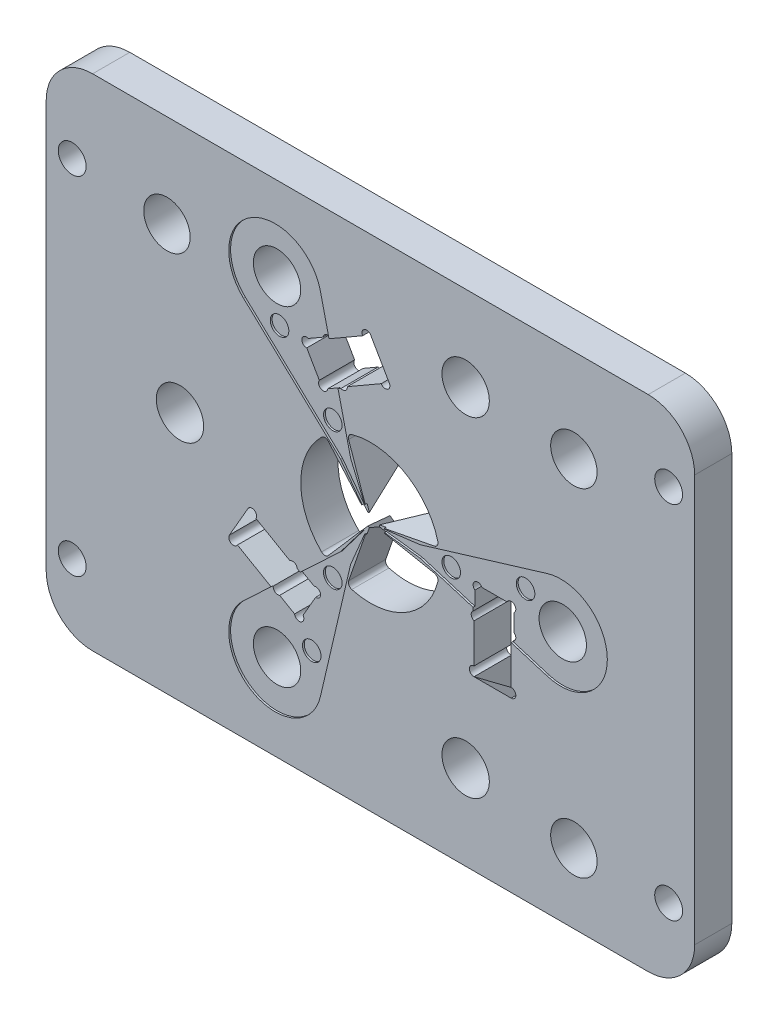
from build123d import *
from build123d.topology import SkipClean

# Parameters (mm, degrees)
SKETCH_1_W           = 76
SKETCH_1_H           = 60
EXTRUDE_1_DEPTH      = 4
CUT_EXTRUDE_1_DEPTH  = 0.5
SKETCH_3_R           = 2.55
CUT_EXTRUDE_2_DEPTH  = 49.541219597
SKETCH_5_R           = 2.55
CUT_EXTRUDE_4_DEPTH  = 49.579831206
SKETCH_6_W           = 76
SKETCH_6_H           = 60
CUT_EXTRUDE_5_DEPTH  = 10
CUT_EXTRUDE_6_DEPTH  = 45.244999717
SKETCH_8_R           = 1.5
CUT_EXTRUDE_7_DEPTH  = 45.244999717
EXTRUDE_START        = 0.5
SKETCH_10_R          = 2.55
EXTRUDE_2_DEPTH      = 0.5
CUT_EXTRUDE_9_DEPTH  = 45.244999717
SKETCH_13_R          = 2.5
CUT_EXTRUDE_10_DEPTH = 45.244999717
SKETCH_14_W          = 4
SKETCH_14_H          = 4.45
CUT_EXTRUDE_11_DEPTH = 0.9
CUT_EXTRUDE_12_DEPTH = 0.2
CUT_EXTRUDE_15_DEPTH = 4
CUT_EXTRUDE_16_DEPTH = 4
CUT_EXTRUDE_17_DEPTH = 4
SKETCH_20_R          = 1.526637958
CUT_EXTRUDE_18_DEPTH = 0.2
SKETCH_21_R          = 1
CUT_EXTRUDE_19_DEPTH = 0.2
CUT_EXTRUDE_20_DEPTH = 45.172729144


with BuildPart() as part:
    # 草圖1 → 填料-伸長1 (new body)
    with BuildSketch(Plane.XY):
        Rectangle(SKETCH_1_W, SKETCH_1_H)
    extrude(amount=EXTRUDE_1_DEPTH)

    # 草圖2 → 除料-伸長1 (cut)
    with BuildSketch(Plane.XY.offset(4)):
        with BuildLine():
            Line((0.357380647, 0.004961492), (4.50941379, 0.523267787))
            ThreePointArc((4.50941379, 0.523267787), (5.349803134, 0.664770922), (6.175092484, 0.877314741))
            Line((6.175092484, 0.877314741), (19.047808057, 4.784468472))
            ThreePointArc((19.047808057, 4.784468472), (25.5, 0), (19.047808057, -4.784468472))
            Line((19.047808057, -4.784468472), (6.175092484, -0.877314741))
            ThreePointArc((6.175092484, -0.877314741), (5.349803134, -0.664770922), (4.50941379, -0.523267787))
            Line((4.50941379, -0.523267787), (0.357380647, -0.004961492))
            ThreePointArc((0.357380647, -0.004961492), (0.353, 0), (0.357380647, 0.004961492))
        make_face()
        with BuildLine():
            Line((-2.327769389, -5.786444332), (-5.380432788, -18.8881199))
            ThreePointArc((-5.380432788, -18.8881199), (-12.75, -22.083647797), (-13.667375269, -14.103651428))
            Line((-13.667375269, -14.103651428), (-3.847323094, -4.909129591))
            ThreePointArc((-3.847323094, -4.909129591), (-3.250610073, -4.300679958), (-2.707870091, -3.643633005))
            Line((-2.707870091, -3.643633005), (-0.182987102, -0.307019973))
            ThreePointArc((-0.182987102, -0.307019973), (-0.1765, -0.305706968), (-0.174393546, -0.311981465))
            Line((-0.174393546, -0.311981465), (-1.801543699, -4.166900792))
            ThreePointArc((-1.801543699, -4.166900792), (-2.09919306, -4.96545088), (-2.327769389, -5.786444332))
        make_face()
        with BuildLine():
            Line((-3.847323094, 4.909129591), (-13.667375269, 14.103651428))
            ThreePointArc((-13.667375269, 14.103651428), (-12.75, 22.083647797), (-5.380432788, 18.8881199))
            Line((-5.380432788, 18.8881199), (-2.327769389, 5.786444332))
            ThreePointArc((-2.327769389, 5.786444332), (-2.09919306, 4.96545088), (-1.801543699, 4.166900792))
            Line((-1.801543699, 4.166900792), (-0.174393546, 0.311981465))
            ThreePointArc((-0.174393546, 0.311981465), (-0.1765, 0.305706968), (-0.182987102, 0.307019973))
            Line((-0.182987102, 0.307019973), (-2.707870091, 3.643633005))
            ThreePointArc((-2.707870091, 3.643633005), (-3.250610073, 4.300679958), (-3.847323094, 4.909129591))
        make_face()
    extrude(amount=-CUT_EXTRUDE_1_DEPTH, mode=Mode.SUBTRACT)

    # 草圖3 → 除料-伸長2 (cut, through all)
    with BuildSketch(Plane.XY.offset(3.5)):
        with Locations((20.5, 0)):
            Circle(SKETCH_3_R)
        with Locations((-10.25, -17.753520778)):
            Circle(SKETCH_3_R)
        with Locations((-10.25, 17.753520778)):
            Circle(SKETCH_3_R)
    extrude(amount=-CUT_EXTRUDE_2_DEPTH, mode=Mode.SUBTRACT)

    # 草圖5 → 除料-伸長4 (cut, through all)
    with BuildSketch(Plane.XY.offset(4)):
        with Locations((-20.5, 0)):
            Circle(SKETCH_5_R)
        with Locations((10.25, 17.753520778)):
            Circle(SKETCH_5_R)
        with Locations((10.25, -17.753520778)):
            Circle(SKETCH_5_R)
    extrude(amount=-CUT_EXTRUDE_4_DEPTH, mode=Mode.SUBTRACT)

    # 草圖6 → 除料-伸長5 (cut)
    with BuildSketch(Plane.XY.offset(4)):
        Rectangle(SKETCH_6_W, SKETCH_6_H)
        with BuildLine():
            ThreePointArc((-34.9, 21.9), (-33.435533906, 25.435533906), (-29.9, 26.9))
            Line((-29.9, 26.9), (29.9, 26.9))
            ThreePointArc((29.9, 26.9), (33.435533906, 25.435533906), (34.9, 21.9))
            Line((34.9, 21.9), (34.9, -21.9))
            ThreePointArc((34.9, -21.9), (33.435533906, -25.435533906), (29.9, -26.9))
            Line((29.9, -26.9), (-29.9, -26.9))
            ThreePointArc((-29.9, -26.9), (-33.435533906, -25.435533906), (-34.9, -21.9))
            Line((-34.9, -21.9), (-34.9, 21.9))
        make_face(mode=Mode.SUBTRACT)
    extrude(amount=-CUT_EXTRUDE_5_DEPTH, mode=Mode.SUBTRACT)

    # 草圖7 → 除料-伸長6 (cut, through all)
    with BuildSketch(Plane.XY.offset(4)):
        with BuildLine():
            ThreePointArc((11.798296094, -0.228571429), (11.03056096, -0.065346), (11.05, -0.85))
            Line((11.05, -0.85), (11.05, -2.707142857))
            ThreePointArc((11.05, -2.707142857), (11.03056096, -3.491796857), (11.798296094, -3.328571429))
            Line((11.798296094, -3.328571429), (14.501703906, -3.328571429))
            ThreePointArc((14.501703906, -3.328571429), (15.26943904, -3.491796857), (15.25, -2.707142857))
            Line((15.25, -2.707142857), (15.25, -0.85))
            ThreePointArc((15.25, -0.85), (15.26943904, -0.065346), (14.501703906, -0.228571429))
            Line((14.501703906, -0.228571429), (11.798296094, -0.228571429))
        make_face()
        with BuildLine():
            ThreePointArc((-6.888878407, 13.631887408), (-7.578128224, 13.25639511), (-7.052903289, 12.673129695))
            Line((-7.052903289, 12.673129695), (-5.701199383, 10.331909853))
            ThreePointArc((-5.701199383, 10.331909853), (-5.458689184, 9.585419009), (-4.788878407, 9.994580712))
            Line((-4.788878407, 9.994580712), (-3.180545514, 10.92315214))
            ThreePointArc((-3.180545514, 10.92315214), (-2.491295697, 11.298644438), (-3.016520631, 11.881909853))
            Line((-3.016520631, 11.881909853), (-4.368224538, 14.223129695))
            ThreePointArc((-4.368224538, 14.223129695), (-4.610734737, 14.969620539), (-5.280545514, 14.560458836))
            Line((-5.280545514, 14.560458836), (-6.888878407, 13.631887408))
        make_face()
        with BuildLine():
            Line((15.15, -7.778571429), (11.15, -7.778571429))
            ThreePointArc((11.15, -7.778571429), (10.65, -8.278571429), (11.15, -8.778571429))
            Line((11.15, -8.778571429), (15.15, -8.778571429))
            ThreePointArc((15.15, -8.778571429), (15.65, -8.278571429), (15.15, -7.778571429))
        make_face()
        with BuildLine():
            Line((2.027465866, 14.045468966), (0.027465866, 17.509570582))
            ThreePointArc((0.027465866, 17.509570582), (-0.655546836, 17.692583284), (-0.838559538, 17.009570582))
            Line((-0.838559538, 17.009570582), (1.161440462, 13.545468966))
            ThreePointArc((1.161440462, 13.545468966), (1.844453164, 13.362456265), (2.027465866, 14.045468966))
        make_face()
        with BuildLine():
            Line((-6.261121593, -9.144580712), (-7.869454486, -8.216009283))
            ThreePointArc((-7.869454486, -8.216009283), (-8.539265263, -7.806847581), (-8.781775462, -8.553338424))
            Line((-8.781775462, -8.553338424), (-10.133479369, -10.894558267))
            ThreePointArc((-10.133479369, -10.894558267), (-10.658704303, -11.477823681), (-9.969454486, -11.853315979))
            Line((-9.969454486, -11.853315979), (-8.361121593, -12.781887408))
            ThreePointArc((-8.361121593, -12.781887408), (-7.691310816, -13.19104911), (-7.448800617, -12.444558267))
            Line((-7.448800617, -12.444558267), (-6.097096711, -10.103338424))
            ThreePointArc((-6.097096711, -10.103338424), (-5.571871776, -9.520073009), (-6.261121593, -9.144580712))
        make_face()
        with BuildLine():
            Line((-14.311440462, -9.230999153), (-12.311440462, -5.766897538))
            ThreePointArc((-12.311440462, -5.766897538), (-12.494453164, -5.083884836), (-13.177465866, -5.266897538))
            Line((-13.177465866, -5.266897538), (-15.177465866, -8.730999153))
            ThreePointArc((-15.177465866, -8.730999153), (-14.994453164, -9.414011855), (-14.311440462, -9.230999153))
        make_face()
    extrude(amount=-CUT_EXTRUDE_6_DEPTH, mode=Mode.SUBTRACT)

    # 草圖8 → 除料-伸長7 (cut, through all)
    with BuildSketch(Plane.XY):
        with Locations((-32.1, 17.9)):
            Circle(SKETCH_8_R)
        with Locations((32.1, 19.4)):
            Circle(SKETCH_8_R)
        with Locations((32.1, -19.4)):
            Circle(SKETCH_8_R)
        with Locations((-32.1, -19.4)):
            Circle(SKETCH_8_R)
    extrude(amount=CUT_EXTRUDE_7_DEPTH, mode=Mode.SUBTRACT)

    # 草圖10 → 填料-伸長2 (add)
    # profile 1 of 3: a face of its own
    with SkipClean():  # the faces are left unmerged after this step: merging them gives an invalid solid
        with BuildSketch(Plane.XY.offset(3.5).offset(EXTRUDE_START)):
            with BuildLine():
                Line((-3.847323094, -4.909129591), (-7.56618458, -8.391102245))
                Line((-7.56618458, -8.391102245), (-6.261121593, -9.144580712))
                ThreePointArc((-6.261121593, -9.144580712), (-5.571871776, -9.520073009), (-6.097096711, -10.103338424))
                Line((-6.097096711, -10.103338424), (-7.448800617, -12.444558267))
                ThreePointArc((-7.448800617, -12.444558267), (-7.691310816, -13.19104911), (-8.361121593, -12.781887408))
                Line((-8.361121593, -12.781887408), (-9.969454486, -11.853315979))
                ThreePointArc((-9.969454486, -11.853315979), (-10.48667114, -11.777022627), (-10.653138837, -11.281419712))
                Line((-10.653138837, -11.281419712), (-13.667375269, -14.103651428))
                ThreePointArc((-13.667375269, -14.103651428), (-12.75, -22.083647797), (-5.380432788, -18.8881199))
                Line((-5.380432788, -18.8881199), (-2.327769389, -5.786444332))
                ThreePointArc((-2.327769389, -5.786444332), (-2.09919306, -4.96545088), (-1.801543699, -4.166900792))
                Line((-1.801543699, -4.166900792), (-0.174393546, -0.311981465))
                ThreePointArc((-0.174393546, -0.311981465), (-0.1765, -0.305706968), (-0.182987102, -0.307019973))
                Line((-0.182987102, -0.307019973), (-2.707870091, -3.643633005))
                ThreePointArc((-2.707870091, -3.643633005), (-3.250610073, -4.300679958), (-3.847323094, -4.909129591))
            make_face()
            with Locations((-10.25, -17.753520778)):
                Circle(SKETCH_10_R, mode=Mode.SUBTRACT)
        # profile 2 of 3: a face of its own
        with BuildSketch(Plane.XY.offset(3.5).offset(EXTRUDE_START)):
            with BuildLine():
                Line((11.05, -2.356956933), (11.05, -0.85))
                ThreePointArc((11.05, -0.85), (11.03056096, -0.065346), (11.798296094, -0.228571429))
                Line((11.798296094, -0.228571429), (14.501703906, -0.228571429))
                ThreePointArc((14.501703906, -0.228571429), (15.26943904, -0.065346), (15.25, -0.85))
                Line((15.25, -0.85), (15.25, -2.707142857))
                ThreePointArc((15.25, -2.707142857), (15.442536346, -3.193212295), (15.09656548, -3.585179007))
                Line((15.09656548, -3.585179007), (19.047808057, -4.784468472))
                ThreePointArc((19.047808057, -4.784468472), (25.5, 0), (19.047808057, 4.784468472))
                Line((19.047808057, 4.784468472), (6.175092484, 0.877314741))
                ThreePointArc((6.175092484, 0.877314741), (5.349803134, 0.664770922), (4.50941379, 0.523267787))
                Line((4.50941379, 0.523267787), (0.357380647, 0.004961492))
                ThreePointArc((0.357380647, 0.004961492), (0.353, 0), (0.357380647, -0.004961492))
                Line((0.357380647, -0.004961492), (4.50941379, -0.523267787))
                ThreePointArc((4.50941379, -0.523267787), (5.349803134, -0.664770922), (6.175092484, -0.877314741))
                Line((6.175092484, -0.877314741), (11.05, -2.356956933))
            make_face()
            with Locations((20.5, 0)):
                Circle(SKETCH_10_R, mode=Mode.SUBTRACT)
        # profile 3 of 3: a face of its own
        with BuildSketch(Plane.XY.offset(3.5).offset(EXTRUDE_START)):
            with BuildLine():
                Line((-3.48381542, 10.748059178), (-4.788878407, 9.994580712))
                ThreePointArc((-4.788878407, 9.994580712), (-5.458689184, 9.585419009), (-5.701199383, 10.331909853))
                Line((-5.701199383, 10.331909853), (-7.052903289, 12.673129695))
                ThreePointArc((-7.052903289, 12.673129695), (-7.578128224, 13.25639511), (-6.888878407, 13.631887408))
                Line((-6.888878407, 13.631887408), (-5.280545514, 14.560458836))
                ThreePointArc((-5.280545514, 14.560458836), (-4.955865206, 14.970234922), (-4.443426643, 14.866598719))
                Line((-4.443426643, 14.866598719), (-5.380432788, 18.8881199))
                ThreePointArc((-5.380432788, 18.8881199), (-12.75, 22.083647797), (-13.667375269, 14.103651428))
                Line((-13.667375269, 14.103651428), (-3.847323094, 4.909129591))
                ThreePointArc((-3.847323094, 4.909129591), (-3.250610073, 4.300679958), (-2.707870091, 3.643633005))
                Line((-2.707870091, 3.643633005), (-0.182987102, 0.307019973))
                ThreePointArc((-0.182987102, 0.307019973), (-0.1765, 0.305706968), (-0.174393546, 0.311981465))
                Line((-0.174393546, 0.311981465), (-1.801543699, 4.166900792))
                ThreePointArc((-1.801543699, 4.166900792), (-2.09919306, 4.96545088), (-2.327769389, 5.786444332))
                Line((-2.327769389, 5.786444332), (-3.48381542, 10.748059178))
            make_face()
            with Locations((-10.25, 17.753520778)):
                Circle(SKETCH_10_R, mode=Mode.SUBTRACT)
        extrude(amount=-EXTRUDE_2_DEPTH)

    # 草圖11 → 除料-伸長9 (cut, through all)
    with SkipClean():  # the faces are left unmerged after this step: merging them gives an invalid solid
        with BuildSketch(Plane.XY.offset(4)):
            with BuildLine():
                Line((6.872043561, 1.260060854), (0.357368236, 0.004959927))
                ThreePointArc((0.357368236, 0.004959927), (0.353, 0), (0.357368236, -0.004959927))
                Line((0.357368236, -0.004959927), (6.872043561, -1.260060854))
                ThreePointArc((6.872043561, -1.260060854), (7.200064401, -1.483823168), (7.261558134, -1.87610593))
                ThreePointArc((7.261558134, -1.87610593), (3.75, -6.495190528), (-2.006023672, -7.22674678))
                ThreePointArc((-2.006023672, -7.22674678), (-2.315003643, -6.977350264), (-2.344777071, -6.581394727))
                Line((-2.344777071, -6.581394727), (-0.174388695, -0.311969934))
                ThreePointArc((-0.174388695, -0.311969934), (-0.1765, -0.305706968), (-0.18297954, -0.307010007))
                Line((-0.18297954, -0.307010007), (-4.52726649, -5.321333873))
                ThreePointArc((-4.52726649, -5.321333873), (-4.885060759, -5.493527096), (-5.255534463, -5.350640851))
                ThreePointArc((-5.255534463, -5.350640851), (-7.5, 0), (-5.255534463, 5.350640851))
                ThreePointArc((-5.255534463, 5.350640851), (-4.885060759, 5.493527096), (-4.52726649, 5.321333873))
                Line((-4.52726649, 5.321333873), (-0.18297954, 0.307010007))
                ThreePointArc((-0.18297954, 0.307010007), (-0.1765, 0.305706968), (-0.174388695, 0.311969934))
                Line((-0.174388695, 0.311969934), (-2.344777071, 6.581394727))
                ThreePointArc((-2.344777071, 6.581394727), (-2.315003643, 6.977350264), (-2.006023672, 7.22674678))
                ThreePointArc((-2.006023672, 7.22674678), (3.75, 6.495190528), (7.261558134, 1.87610593))
                ThreePointArc((7.261558134, 1.87610593), (7.200064401, 1.483823168), (6.872043561, 1.260060854))
            make_face()
        extrude(amount=-CUT_EXTRUDE_9_DEPTH, mode=Mode.SUBTRACT)

    # 草圖12 → 除料-旋轉1 (revolve, cut)
    with SkipClean():  # the faces are left unmerged after this step: merging them gives an invalid solid
        with BuildSketch(Plane(origin=(0, 0, 0), x_dir=(1, 0, 0), z_dir=(0, 1, 0))):
            Polygon((0.353, -4.18), (0.353, 0), (2.766324125, 0), align=None)
        revolve(axis=Axis((0, 0, 0), (0, 0, 1)), mode=Mode.SUBTRACT)

    # 草圖13 → 除料-伸長10 (cut, through all)
    with SkipClean():  # the faces are left unmerged after this step: merging them gives an invalid solid
        with BuildSketch(Plane(origin=(0, 0, 0), x_dir=(-1, 0, 0), z_dir=(0, 0, -1))):
            with Locations((-21.9, 16.9)):
                Circle(SKETCH_13_R)
            with Locations((21.9, 16.9)):
                Circle(SKETCH_13_R)
            with Locations((-21.9, -19.4)):
                Circle(SKETCH_13_R)
        extrude(amount=-CUT_EXTRUDE_10_DEPTH, mode=Mode.SUBTRACT)

    # 草圖14 → 除料-伸長11 (cut)
    with SkipClean():  # the faces are left unmerged after this step: merging them gives an invalid solid
        with BuildSketch(Plane.XY.offset(4)):
            with Locations((13.15, -5.553571429)):
                Rectangle(SKETCH_14_W, SKETCH_14_H)
            Polygon((-4.692372585, 14.784570582), (-2.692372585, 11.320468966), (1.161440462, 13.545468966), (-0.838559538, 17.009570582), align=None)
            Polygon((-14.311440462, -9.230999153), (-12.311440462, -5.766897538), (-8.457627415, -7.991897538), (-10.457627415, -11.455999153), align=None)
        extrude(amount=-CUT_EXTRUDE_11_DEPTH, mode=Mode.SUBTRACT)

    # 草圖15 → 除料-旋轉2 (revolve, cut)
    with SkipClean():  # the faces are left unmerged after this step: merging them gives an invalid solid
        with BuildSketch(Plane(origin=(0, 0, 0), x_dir=(1, 0, 0), z_dir=(0, 1, 0))):
            Polygon((0.353, 0), (0.353, -4.18), (0.553, -4.18), (2.966324125, 0), align=None)
        revolve(axis=Axis((0, 0, 0), (0, 0, 1)), mode=Mode.SUBTRACT)

    # 草圖16 → 除料-伸長12 (cut)
    with SkipClean():  # the faces are left unmerged after this step: merging them gives an invalid solid
        with BuildSketch(Plane.XY.offset(4)):
            with BuildLine():
                Line((0.357380647, 0.004961492), (5.358, 0.629198438))
                Line((5.358, 0.629198438), (19.047772641, 4.784457722))
                ThreePointArc((19.047772641, 4.784457722), (25.5, 0), (19.047772641, -4.784457722))
                Line((19.047772641, -4.784457722), (5.358, -0.629198438))
                Line((5.358, -0.629198438), (0.357380647, -0.004961492))
                ThreePointArc((0.357380647, -0.004961492), (0.353, 0), (0.357380647, 0.004961492))
            make_face()
            with BuildLine():
                Line((-0.182987102, -0.307019973), (-3.223901831, -4.325564895))
                Line((-3.223901831, -4.325564895), (-13.667348251, -14.103626131))
                ThreePointArc((-13.667348251, -14.103626131), (-12.75, -22.083647797), (-5.380424389, -18.888083853))
                Line((-5.380424389, -18.888083853), (-2.134098169, -4.954763332))
                Line((-2.134098169, -4.954763332), (-0.174393546, -0.311981465))
                ThreePointArc((-0.174393546, -0.311981465), (-0.1765, -0.305706968), (-0.182987102, -0.307019973))
            make_face()
            with BuildLine():
                Line((-0.174393546, 0.311981465), (-2.134098169, 4.954763332))
                Line((-2.134098169, 4.954763332), (-5.380424389, 18.888083853))
                ThreePointArc((-5.380424389, 18.888083853), (-12.75, 22.083647797), (-13.667348251, 14.103626131))
                Line((-13.667348251, 14.103626131), (-3.223901831, 4.325564895))
                Line((-3.223901831, 4.325564895), (-0.182987102, 0.307019973))
                ThreePointArc((-0.182987102, 0.307019973), (-0.1765, 0.305706968), (-0.174393546, 0.311981465))
            make_face()
        extrude(amount=-CUT_EXTRUDE_12_DEPTH, mode=Mode.SUBTRACT)

    # 草圖17 → 除料-伸長15 (cut)
    with SkipClean():  # the faces are left unmerged after this step: merging them gives an invalid solid
        with BuildSketch(Plane(origin=(11.15, 0, 0), x_dir=(0, 0, -1), z_dir=(1, 0, 0))):
            Polygon((0, -11.778571429), (0, -8.778571429), (-4, -8.778571429), align=None)
        extrude(amount=CUT_EXTRUDE_15_DEPTH, mode=Mode.SUBTRACT)

    # 草圖18 → 除料-伸長16 (cut)
    with SkipClean():  # the faces are left unmerged after this step: merging them gives an invalid solid
        with BuildSketch(Plane(origin=(-5.575, 9.656183252, 0), x_dir=(0.8660254037844387, 0.4999999999999999, 0), z_dir=(-0.49999999999999994, 0.8660254037844388, 0))):
            Polygon((8.778571429, -4), (8.778571429, 0), (11.778571429, 0), align=None)
        extrude(amount=CUT_EXTRUDE_16_DEPTH, mode=Mode.SUBTRACT)

    # 草圖19 → 除料-伸長17 (cut)
    with SkipClean():  # the faces are left unmerged after this step: merging them gives an invalid solid
        with BuildSketch(Plane(origin=(-5.575, -9.656183252, 0), x_dir=(-0.8660254037844386, 0.5000000000000003, 0), z_dir=(-0.5000000000000002, -0.8660254037844385, 0))):
            Polygon((8.778571429, -4), (8.778571429, 0), (11.778571429, 0), align=None)
        extrude(amount=CUT_EXTRUDE_17_DEPTH, mode=Mode.SUBTRACT)

    # 草圖20 → 除料-伸長18 (cut)
    with SkipClean():  # the faces are left unmerged after this step: merging them gives an invalid solid
        with BuildSketch(Plane.XY.offset(4)):
            Circle(SKETCH_20_R)
        extrude(amount=-CUT_EXTRUDE_18_DEPTH, mode=Mode.SUBTRACT)

    # 草圖21 → 除料-伸長19 (cut)
    with SkipClean():  # the faces are left unmerged after this step: merging them gives an invalid solid
        with BuildSketch(Plane.XY.offset(3.8)):
            with Locations((8.5, 0)):
                Circle(SKETCH_21_R)
            with Locations((16.5, 2)):
                Circle(SKETCH_21_R)
            with Locations((-6.517949192, -15.289419162)):
                Circle(SKETCH_21_R)
            with Locations((-4.25, -7.361215932)):
                Circle(SKETCH_21_R)
            with Locations((-9.982050808, 13.289419162)):
                Circle(SKETCH_21_R)
            with Locations((-4.25, 7.361215932)):
                Circle(SKETCH_21_R)
        extrude(amount=-CUT_EXTRUDE_19_DEPTH, mode=Mode.SUBTRACT)

    # 草圖22 → 除料-伸長20 (cut, through all)
    with SkipClean():  # the faces are left unmerged after this step: merging them gives an invalid solid
        with BuildSketch(Plane.XY.offset(3.1)):
            with BuildLine():
                Line((-4.368224538, 14.223129695), (-3.016520631, 11.881909853))
                ThreePointArc((-3.016520631, 11.881909853), (-2.663194684, 11.766361753), (-2.487272656, 11.438883466))
                Line((-2.487272656, 11.438883466), (1.161440462, 13.545468966))
                Line((1.161440462, 13.545468966), (-0.838559538, 17.009570582))
                Line((-0.838559538, 17.009570582), (-4.487272656, 14.902985081))
                ThreePointArc((-4.487272656, 14.902985081), (-4.291629154, 14.586892992), (-4.368224538, 14.223129695))
            make_face()
            with BuildLine():
                Line((-10.133479369, -10.894558267), (-8.781775462, -8.553338424))
                ThreePointArc((-8.781775462, -8.553338424), (-8.858370846, -8.189575128), (-8.662727344, -7.873483039))
                Line((-8.662727344, -7.873483039), (-12.311440462, -5.766897538))
                Line((-12.311440462, -5.766897538), (-14.311440462, -9.230999153))
                Line((-14.311440462, -9.230999153), (-10.662727344, -11.337584654))
                ThreePointArc((-10.662727344, -11.337584654), (-10.486805316, -11.010106366), (-10.133479369, -10.894558267))
            make_face()
            with BuildLine():
                Line((14.501703906, -3.328571429), (11.798296094, -3.328571429))
                ThreePointArc((11.798296094, -3.328571429), (11.52156553, -3.576786625), (11.15, -3.565400427))
                Line((11.15, -3.565400427), (11.15, -7.778571429))
                Line((11.15, -7.778571429), (15.15, -7.778571429))
                Line((15.15, -7.778571429), (15.15, -3.565400427))
                ThreePointArc((15.15, -3.565400427), (14.77843447, -3.576786625), (14.501703906, -3.328571429))
            make_face()
        extrude(amount=-CUT_EXTRUDE_20_DEPTH, mode=Mode.SUBTRACT)


solid = part.part
